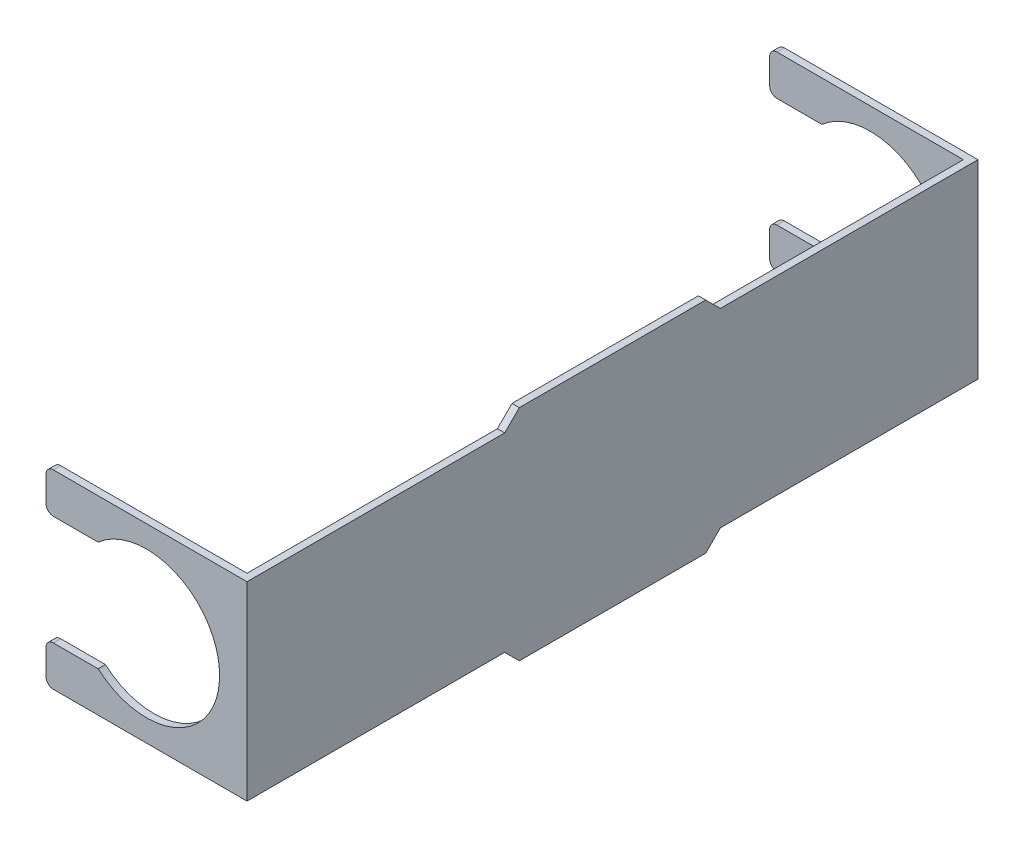
from build123d import *

# Parameters (mm, degrees)
SKETCH1_W           = 11
SKETCH1_H           = 12
BOSS_EXTRUDE1_DEPTH = 40
SKETCH2_W           = 10.6
SKETCH2_H           = 39.2
CUT_EXTRUDE1_DEPTH  = 43.121847063
CUT_EXTRUDE2_DEPTH  = 0.8
CHAMFER1_SIZE       = 0.8
CUT_EXTRUDE3_DEPTH  = 41.819725624
FILLET1_R           = 0.4


with BuildPart() as part:
    # Sketch1 → Boss-Extrude1 (new body)
    with BuildSketch(Plane.XY):
        Rectangle(SKETCH1_W, SKETCH1_H)
    extrude(amount=BOSS_EXTRUDE1_DEPTH)

    # Sketch2 → Cut-Extrude1 (cut, through all)
    with BuildSketch(Plane(origin=(0, 6, 0), x_dir=(1, 0, 0), z_dir=(0, 1, 0))):
        with Locations((-0.2, -20)):
            Rectangle(SKETCH2_W, SKETCH2_H)
    extrude(amount=-CUT_EXTRUDE1_DEPTH, mode=Mode.SUBTRACT)

    # Sketch3 → Cut-Extrude2 (cut)
    with BuildSketch(Plane(origin=(0, 6, 0), x_dir=(1, 0, 0), z_dir=(0, 1, 0))):
        Polygon((-5.5, 0), (5.5, 0), (5.5, -14.1), (5.1, -14.1), (5.1, -25.9), (5.5, -25.9), (5.5, -40), (-5.5, -40), align=None)
    cut_extrude2 = extrude(amount=-CUT_EXTRUDE2_DEPTH, mode=Mode.SUBTRACT)

    # Mirror1: Cut-Extrude2 across plane
    add(cut_extrude2.mirror(Plane.ZX), mode=Mode.SUBTRACT)

    # Chamfer1
    chamfer1_edges = [part.edges().sort_by_distance(p)[0] for p in [
        (5.3, -6, 25.9),
        (5.3, -6, 14.1),
        (5.3, 6, 25.9),
        (5.3, 6, 14.1),
    ]]
    chamfer(chamfer1_edges, length=CHAMFER1_SIZE - 0.0001)  # a hair under: the kernel refuses the full size

    # Sketch4 → Cut-Extrude3 (cut, through all)
    with BuildSketch(Plane(origin=(0, 0, 0), x_dir=(-1, 0, 0), z_dir=(0, 0, -1))):
        with BuildLine():
            Line((5.5, -3), (2.645751311, -3))
            ThreePointArc((2.645751311, -3), (-4, 0), (2.645751311, 3))
            Line((2.645751311, 3), (5.5, 3))
            Line((5.5, 3), (5.5, -3))
        make_face()
    extrude(amount=-CUT_EXTRUDE3_DEPTH, mode=Mode.SUBTRACT)

    # Fillet1
    fillet1_edges = [part.edges().sort_by_distance(p)[0] for p in [
        (-5.5, 3, 0.2),
        (-5.5, 3, 39.8),
        (-5.5, -3, 0.2),
        (-5.5, -3, 39.8),
        (-5.5, 5.2, 0.2),
        (-5.5, 5.2, 39.8),
        (-5.5, -5.2, 39.8),
        (-5.5, -5.2, 0.2),
    ]]
    fillet(fillet1_edges, radius=FILLET1_R)


solid = part.part
